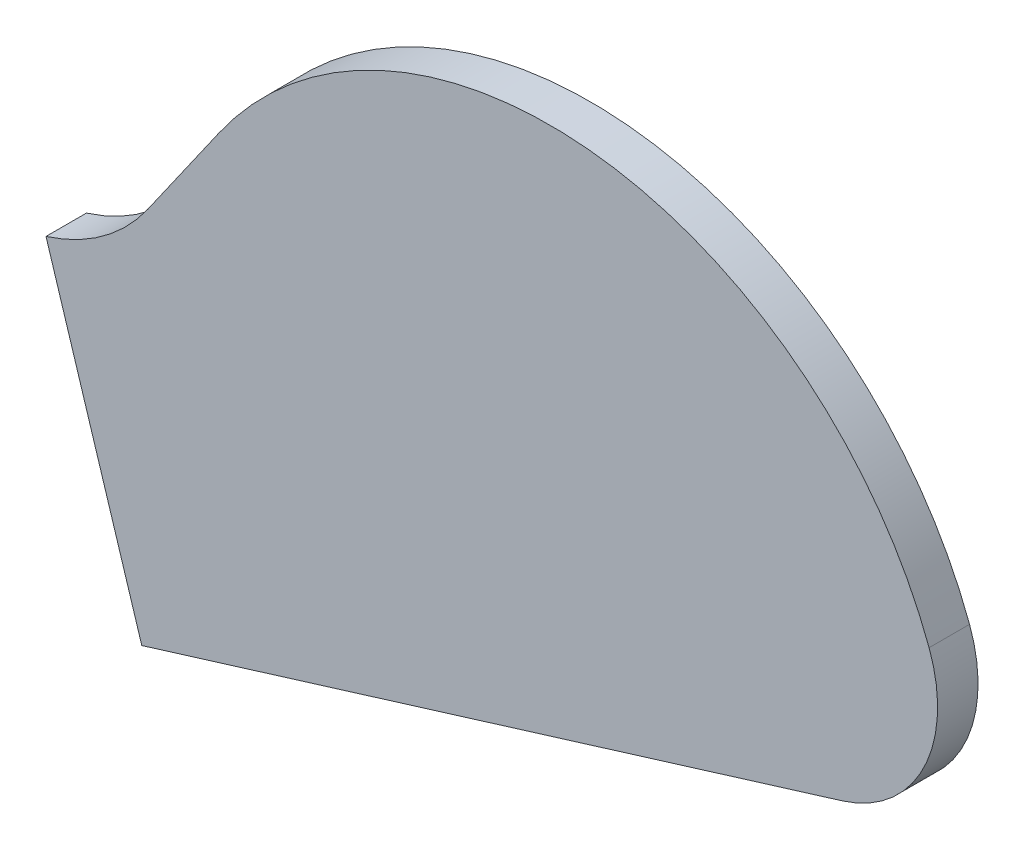
from build123d import *

# Parameters (mm, degrees)
BOSS_EXTRUDE1_START     = -3
BOSS_EXTRUDE1_OUTLINE_R = 2.5
BOSS_EXTRUDE1_DEPTH     = 3
FILLET1_R               = 10
BOSS_EXTRUDE2_START     = -3
BOSS_EXTRUDE2_DEPTH     = 3
CUT_EXTRUDE1_START      = -3
CUT_EXTRUDE1_DEPTH      = 3
FILLET2_R               = 10
CUT_EXTRUDE2_DEPTH      = 103.947966144
CUT_EXTRUDE2_DEPTH_BACK = 103.947966144


with BuildPart() as part:
    # Boss-Extrude1: read off the stored shape, not the designer's step
    # Boss-Extrude1 outline → Boss-Extrude1 (new body)
    with BuildSketch(Plane.XY.offset(3).offset(BOSS_EXTRUDE1_START)):
        with BuildLine():
            ThreePointArc((-24.364065342, 16.876742294), (-25.101814907, 17.696096192), (-26.161653435, 18))
            Line((-26.161653435, 18), (-27.830556346, 18))
            ThreePointArc((-27.830556346, 18), (-29.526652538, 17.059838528), (-29.628144438, 15.123257706))
            Line((-29.628144438, 15.123257706), (-16.550964109, -11.68893536))
            ThreePointArc((-16.550964109, -11.68893536), (-15.603505287, -14.937815984), (-15.793938159, -18.316667689))
            Line((-15.793938159, -18.316667689), (-24.617449619, -56.633968709))
            ThreePointArc((-24.617449619, -56.633968709), (-12.550978841, -74.781492041), (4.900124379, -61.728089553))
            Line((4.900124379, -61.728089553), (7.520756747, -39.132184047))
            Line((7.520756747, -39.132184047), (57.484416951, -6.361887987))
            ThreePointArc((57.484416951, -6.361887987), (61.581724267, 4.861915454), (52, 12))
            Line((52, 12), (41.720733512, 12))
            ThreePointArc((41.720733512, 12), (27.868275115, 8.610324995), (17.146172183, -0.792706909))
            Line((17.146172183, -0.792706909), (11.877704642, -8.316858327))
            ThreePointArc((11.877704642, -8.316858327), (-1.137656888, -14.455301339), (-13.032513671, -6.356381628))
            Line((-13.032513671, -6.356381628), (-24.364065342, 16.876742294))
        make_face()
        with Locations((-10, -60)):
            Circle(BOSS_EXTRUDE1_OUTLINE_R, mode=Mode.SUBTRACT)
    extrude(amount=BOSS_EXTRUDE1_DEPTH)

    # Fillet1
    fillet1_edges = [part.edges().sort_by_distance(p)[0] for p in [
        (7.520756747, -39.132184047, 1.5),
    ]]
    fillet(fillet1_edges, radius=FILLET1_R)

    # Sketch2 → Boss-Extrude2 (add)
    with BuildSketch(Plane.XY.offset(3).offset(BOSS_EXTRUDE2_START)):
        with BuildLine():
            Line((11.431019345, -36.567510792), (71.720733512, -18))
            ThreePointArc((71.720733512, -18), (69.105682696, -5.749915992), (61.716429632, 4.364528537))
            ThreePointArc((61.716429632, 4.364528537), (61.302173782, -1.670090316), (57.484416951, -6.361887987))
            Line((57.484416951, -6.361887987), (11.431019345, -36.567510792))
        make_face()
    extrude(amount=BOSS_EXTRUDE2_DEPTH)

    # Sketch2<4> → Cut-Extrude1 (cut)
    with BuildSketch(Plane.XY.offset(3).offset(CUT_EXTRUDE1_START)):
        with BuildLine():
            ThreePointArc((41.720733512, 12), (52.42269931, 10.026200742), (61.716429632, 4.364528537))
            ThreePointArc((61.716429632, 4.364528537), (58.178782835, 9.862737607), (52, 12))
            Line((52, 12), (41.720733512, 12))
        make_face()
    extrude(amount=CUT_EXTRUDE1_DEPTH, mode=Mode.SUBTRACT)

    # Fillet2
    fillet2_edges = [part.edges().sort_by_distance(p)[0] for p in [
        (71.720733512, -18, 1.5),
    ]]
    fillet(fillet2_edges, radius=FILLET2_R)

    # Sketch3 → Cut-Extrude2 (cut, two sides: drawn at the far end of the back side and taken through both)
    with BuildSketch(Plane.XY.offset(3).offset(-CUT_EXTRUDE2_DEPTH_BACK)):
        Polygon((-108.405592733, 346.786455555), (-15.36308768, 49.146087288), (29.942477709, -95.785147736), (122.984982762, -393.425516003), (-472.295753771, -579.510526109), (-703.686329267, 160.701445449), align=None)
    extrude(amount=CUT_EXTRUDE2_DEPTH + CUT_EXTRUDE2_DEPTH_BACK, mode=Mode.SUBTRACT)


solid = part.part
